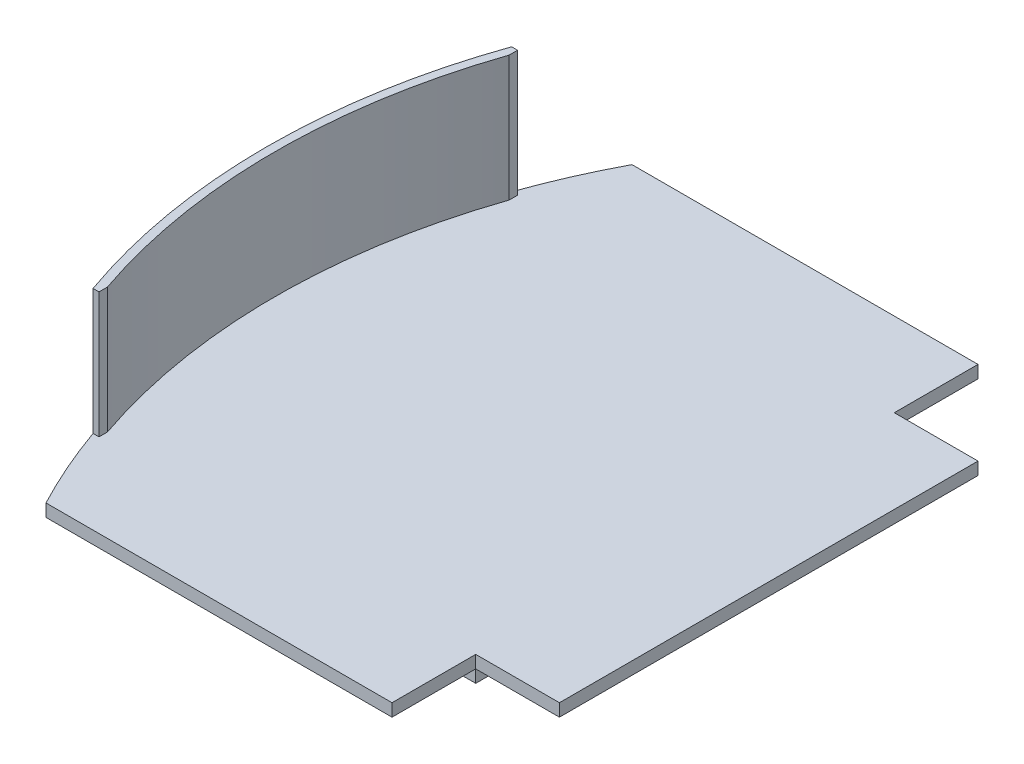
from build123d import *

# Parameters (mm, degrees)
BOSS_EXTRUDE1_DEPTH = 6
BOSS_EXTRUDE2_DEPTH = 30
SKETCH3_W           = 20
SKETCH3_H           = 100
CUT_EXTRUDE1_DEPTH  = 3
SHELL1_START        = 2
SHELL1_DEPTH        = 32
SHELL1_START_2      = 5
SHELL1_2_OUTLINE_W  = 2
SHELL1_2_OUTLINE_H  = 96
SHELL1_2_DEPTH      = 29
BOSS_EXTRUDE3_DEPTH = 6
CUT_EXTRUDE2_START  = -2
CUT_EXTRUDE2_DEPTH  = 2
SKETCH8_W           = 21
SKETCH8_H           = 44
CUT_EXTRUDE3_DEPTH  = 3
SKETCH9_W           = 90
SKETCH9_H           = 30
CUT_EXTRUDE4_DEPTH  = 196.437969699


# Read off the part's stored shape, not the designer's step: Shell1
with BuildPart() as part:
    # Sketch1 → Boss-Extrude1 (new body)
    with BuildSketch(Plane(origin=(0, 0, 0), x_dir=(1, 0, 0), z_dir=(0, 1, 0))):
        with BuildLine():
            Line((-50, 50), (-141.421356237, 50))
            ThreePointArc((-141.421356237, 50), (-150, 0), (-141.421356237, -50))
            Line((-141.421356237, -50), (-50, -50))
            Line((-50, -50), (-50, 0))
            Line((-50, 0), (-50, 50))
        make_face()
        with BuildLine():
            Line((-50, -50), (-141.421356237, -50))
            ThreePointArc((-141.421356237, -50), (-137.407538074, -60.159525267), (-132.664991614, -70))
            Line((-132.664991614, -70), (-50, -70))
            Line((-50, -70), (-50, -50))
        make_face()
        Polygon((-30, 50), (-50, 50), (-50, 0), (-50, -50), (-30, -50), (-30, 0), align=None)
        with BuildLine():
            Line((-50, 70), (-132.664991614, 70))
            ThreePointArc((-132.664991614, 70), (-137.407538074, 60.159525267), (-141.421356237, 50))
            Line((-141.421356237, 50), (-50, 50))
            Line((-50, 50), (-50, 70))
        make_face()
    extrude(amount=BOSS_EXTRUDE1_DEPTH)

    # Sketch2 → Boss-Extrude2 (add)
    with BuildSketch(Plane(origin=(0, 6, 0), x_dir=(-1, 0, 0), z_dir=(0, 1, 0))):
        with BuildLine():
            Line((50, 50), (50, -50))
            Line((50, -50), (141.421356237, -50))
            ThreePointArc((141.421356237, -50), (150, 0), (141.421356237, 50))
            Line((141.421356237, 50), (50, 50))
        make_face()
    extrude(amount=BOSS_EXTRUDE2_DEPTH)

    # Sketch3 → Cut-Extrude1 (cut)
    with BuildSketch(Plane.XZ):
        with BuildLine():
            Line((-50, -70), (-50, -50))
            Line((-50, -50), (-141.421356237, -50))
            ThreePointArc((-141.421356237, -50), (-137.407538074, -60.159525267), (-132.664991614, -70))
            Line((-132.664991614, -70), (-50, -70))
        make_face()
        with Locations((-40, 0)):
            Rectangle(SKETCH3_W, SKETCH3_H)
        with BuildLine():
            Line((-141.421356237, 50), (-50, 50))
            Line((-50, 50), (-50, 70))
            Line((-50, 70), (-132.664991614, 70))
            ThreePointArc((-132.664991614, 70), (-137.407538074, 60.159525267), (-141.421356237, 50))
        make_face()
    extrude(amount=-CUT_EXTRUDE1_DEPTH, mode=Mode.SUBTRACT)

    # Shell1 outline → Shell1 (cut)
    with BuildSketch(Plane(origin=(0, 0, 0), x_dir=(1, 0, 0), z_dir=(0, 1, 0)).offset(SHELL1_START)):
        with BuildLine():
            Line((-140, -48), (-52, -48))
            Line((-52, -48), (-52, 48))
            Line((-52, 48), (-140, 48))
            ThreePointArc((-140, 48), (-148, 0), (-140, -48))
        make_face()
    extrude(amount=SHELL1_DEPTH, mode=Mode.SUBTRACT)

    # Shell1 2 outline → Shell1 2 (cut)
    with BuildSketch(Plane(origin=(0, 0, 0), x_dir=(1, 0, 0), z_dir=(0, 1, 0)).offset(SHELL1_START_2)):
        with Locations((-51, 0)):
            Rectangle(SHELL1_2_OUTLINE_W, SHELL1_2_OUTLINE_H)
    extrude(amount=SHELL1_2_DEPTH, mode=Mode.SUBTRACT)

    # Sketch6 → Boss-Extrude3 (add)
    with BuildSketch(Plane.XZ):
        with BuildLine():
            Line((-141.421356237, 50), (-50, 50))
            Line((-50, 50), (-50, -50))
            Line((-50, -50), (-141.421356237, -50))
            ThreePointArc((-141.421356237, -50), (-150, 0), (-141.421356237, 50))
        make_face()
    extrude(amount=-BOSS_EXTRUDE3_DEPTH)

    # Sketch7 → Cut-Extrude2 (cut)
    with BuildSketch(Plane(origin=(0, 36, 0), x_dir=(-1, 0, 0), z_dir=(0, 1, 0)).offset(CUT_EXTRUDE2_START)):
        with BuildLine():
            Line((50, -48), (140, -48))
            ThreePointArc((140, -48), (148, 0), (140, 48))
            Line((140, 48), (50, 48))
            Line((50, 48), (50, -48))
        make_face()
    extrude(amount=CUT_EXTRUDE2_DEPTH, mode=Mode.SUBTRACT)

    # Sketch8 → Cut-Extrude3 (cut)
    with BuildSketch(Plane.XZ):
        with Locations((-120.5, -6)):
            Rectangle(SKETCH8_W, SKETCH8_H)
    extrude(amount=-CUT_EXTRUDE3_DEPTH, mode=Mode.SUBTRACT)

    # Sketch9 → Cut-Extrude4 (cut, through all)
    with BuildSketch(Plane.XY.offset(50)):
        with Locations((-95, 21)):
            Rectangle(SKETCH9_W, SKETCH9_H)
    extrude(amount=-CUT_EXTRUDE4_DEPTH, mode=Mode.SUBTRACT)


solid = part.part
